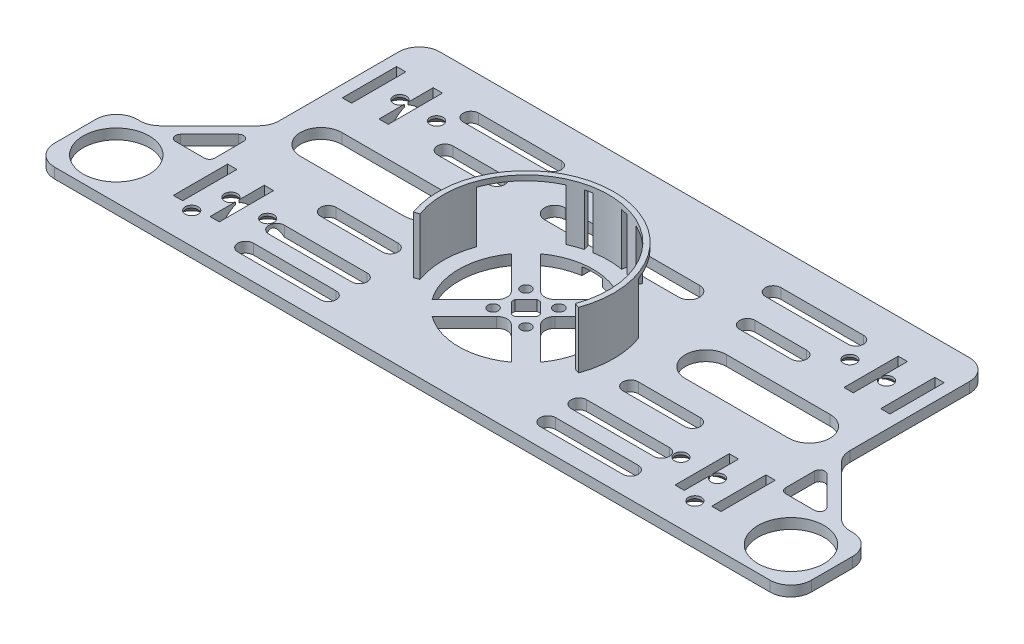
from build123d import *

# Parameters (mm, degrees)
SKETCH_1_R                     = 1
SKETCH_1_R_2                   = 6.4
SKETCH_1_W                     = 1.8
SKETCH_1_H                     = 10.5
EXTRUDE_1_DEPTH                = 2
FILLET_1_R                     = 2
FILLET_2_R                     = 4
FILLET_3_R                     = 1
HOLE_WIZARD_M2_5_3_AT_2_COUNT  = 2
HOLE_WIZARD_M2_5_3_AT_2_PITCH  = 7.1
HOLE_WIZARD_M2_5_3_AT_3_COUNT  = 2
HOLE_WIZARD_M2_5_3_AT_3_PITCH  = 87.1
HOLE_WIZARD_M2_5_3_AT_4_COUNT  = 2
HOLE_WIZARD_M2_5_3_AT_4_PITCH  = 94.2
HOLE_WIZARD_M2_5_3_AT_5_COUNT  = 2
HOLE_WIZARD_M2_5_3_AT_5_PITCH  = 99.714241711
HOLE_WIZARD_M2_5_3_AT_6_COUNT  = 2
HOLE_WIZARD_M2_5_3_AT_6_PITCH  = 103.321488568
HOLE_WIZARD_M2_5_3_AT_7_COUNT  = 2
HOLE_WIZARD_M2_5_3_AT_7_PITCH  = 93.036014532
HOLE_WIZARD_M2_5_3_AT_8_COUNT  = 2
HOLE_WIZARD_M2_5_3_AT_8_PITCH  = 33.461918654
HOLE_WIZARD_M2_5_3_AT_9_COUNT  = 2
HOLE_WIZARD_M2_5_3_AT_9_PITCH  = 38.733060814
HOLE_WIZARD_M2_5_3_AT_10_COUNT = 2
HOLE_WIZARD_M2_5_3_AT_10_PITCH = 32.7
CUT_EXTRUDE_1_DEPTH            = 2
EXTRUDE_2_DEPTH                = 10
EXTRUDE_3_DEPTH                = 1
CUT_EXTRUDE_2_DEPTH            = 1.5


with BuildPart() as part:
    # 草图1 → 凸台-拉伸1 (new body)
    with BuildSketch(Plane(origin=(0, 0, 0), x_dir=(1, 0, 0), z_dir=(0, 1, 0))):
        Polygon((-73.25, 16), (-73.25, 0), (73.25, 0), (73.25, 16), (67.078427125, 16), (55.25, 27.828427125), (55.25, 56.6), (-55.25, 56.6), (-55.25, 27.828427125), (-67.078427125, 16), align=None)
        with Locations(Location((-48.7, 6, 0), (0, 0, 270))):
            Circle(SKETCH_1_R, mode=Mode.SUBTRACT)
        with Locations(Location((-65.3, 8, 0), (0, 0, 270))):
            Circle(SKETCH_1_R_2, mode=Mode.SUBTRACT)
        with Locations((-52.1, 12)):
            Rectangle(SKETCH_1_W, SKETCH_1_H, mode=Mode.SUBTRACT)
        with Locations((-45, 12)):
            Rectangle(SKETCH_1_W, SKETCH_1_H, mode=Mode.SUBTRACT)
        Polygon((-55.25, 25), (-55.25, 16), (-64.25, 16), align=None, mode=Mode.SUBTRACT)
        with Locations(Location((-3.181980515, 18.818019485, 0), (0, 0, 270))):
            Circle(SKETCH_1_R, mode=Mode.SUBTRACT)
        with BuildLine():
            Line((-10.497164625, 29.6687375), (-2.828427125, 22))
            Line((-2.828427125, 22), (-10.497164625, 14.3312625))
            ThreePointArc((-10.497164625, 14.3312625), (-13, 22), (-10.497164625, 29.6687375))
        make_face(mode=Mode.SUBTRACT)
        with Locations(Location((-3.181980515, 25.181980515, 0), (0, 0, 270))):
            Circle(SKETCH_1_R, mode=Mode.SUBTRACT)
        with Locations(Location((48.7, 6, 0), (0, 0, 270))):
            Circle(SKETCH_1_R, mode=Mode.SUBTRACT)
        with Locations((45, 12)):
            Rectangle(SKETCH_1_W, SKETCH_1_H, mode=Mode.SUBTRACT)
        with Locations((52.1, 12)):
            Rectangle(SKETCH_1_W, SKETCH_1_H, mode=Mode.SUBTRACT)
        with Locations(Location((65.3, 8, 0), (0, 0, 270))):
            Circle(SKETCH_1_R_2, mode=Mode.SUBTRACT)
        with BuildLine():
            ThreePointArc((7.6687375, 11.502835375), (0, 9), (-7.6687375, 11.502835375))
            Line((-7.6687375, 11.502835375), (0, 19.171572875))
            Line((0, 19.171572875), (7.6687375, 11.502835375))
        make_face(mode=Mode.SUBTRACT)
        with Locations(Location((3.181980515, 18.818019485, 0), (0, 0, 270))):
            Circle(SKETCH_1_R, mode=Mode.SUBTRACT)
        with BuildLine():
            Line((0.353553391, 24.474873734), (2.474873734, 22.353553391))
            ThreePointArc((2.474873734, 22.353553391), (2.5, 22), (2.474873734, 21.646446609))
            Line((2.474873734, 21.646446609), (0.353553391, 19.525126266))
            ThreePointArc((0.353553391, 19.525126266), (0, 19.5), (-0.353553391, 19.525126266))
            Line((-0.353553391, 19.525126266), (-2.474873734, 21.646446609))
            ThreePointArc((-2.474873734, 21.646446609), (-2.5, 22), (-2.474873734, 22.353553391))
            Line((-2.474873734, 22.353553391), (-0.353553391, 24.474873734))
            ThreePointArc((-0.353553391, 24.474873734), (0, 24.5), (0.353553391, 24.474873734))
        make_face(mode=Mode.SUBTRACT)
        with BuildLine():
            Line((2.828427125, 22), (10.497164625, 29.6687375))
            ThreePointArc((10.497164625, 29.6687375), (13, 22), (10.497164625, 14.3312625))
            Line((10.497164625, 14.3312625), (2.828427125, 22))
        make_face(mode=Mode.SUBTRACT)
        with Locations(Location((3.181980515, 25.181980515, 0), (0, 0, 270))):
            Circle(SKETCH_1_R, mode=Mode.SUBTRACT)
        Polygon((64.25, 16), (55.25, 16), (55.25, 25), align=None, mode=Mode.SUBTRACT)
        with BuildLine():
            Line((7.6687375, 32.497164625), (0, 24.828427125))
            Line((0, 24.828427125), (-7.6687375, 32.497164625))
            ThreePointArc((-7.6687375, 32.497164625), (0, 35), (7.6687375, 32.497164625))
        make_face(mode=Mode.SUBTRACT)
        with Locations((-52.1, 44.7)):
            Rectangle(SKETCH_1_W, SKETCH_1_H, mode=Mode.SUBTRACT)
        with Locations((-45, 44.7)):
            Rectangle(SKETCH_1_W, SKETCH_1_H, mode=Mode.SUBTRACT)
        with BuildLine():
            ThreePointArc((-13, 38.6), (-15, 40.6), (-13, 42.6))
            Line((-13, 42.6), (13, 42.6))
            ThreePointArc((13, 42.6), (15, 40.6), (13, 38.6))
            Line((13, 38.6), (-13, 38.6))
        make_face(mode=Mode.SUBTRACT)
        with Locations((45, 44.7)):
            Rectangle(SKETCH_1_W, SKETCH_1_H, mode=Mode.SUBTRACT)
        with Locations((52.1, 44.7)):
            Rectangle(SKETCH_1_W, SKETCH_1_H, mode=Mode.SUBTRACT)
    extrude(amount=EXTRUDE_1_DEPTH)

    # 圆角1
    fillet_1_edges = [part.edges().sort_by_distance(p)[0] for p in [
        (2.828427125, 1, -22),
        (-2.828427125, 1, -22),
        (0, 1, -24.828427125),
        (0, 1, -19.171572875),
    ]]
    fillet(fillet_1_edges, radius=FILLET_1_R)

    # 圆角2
    fillet_2_edges = [part.edges().sort_by_distance(p)[0] for p in [
        (-55.25, 1, -56.6),
        (55.25, 1, -56.6),
        (55.25, 1, -27.828427125),
        (67.078427125, 1, -16),
        (73.25, 1, -16),
        (73.25, 1, 0),
        (-73.25, 1, 0),
        (-73.25, 1, -16),
        (-67.078427125, 1, -16),
        (-55.25, 1, -27.828427125),
    ]]
    fillet(fillet_2_edges, radius=FILLET_2_R)

    # 圆角3
    fillet_3_edges = [part.edges().sort_by_distance(p)[0] for p in [
        (55.25, 1, -25),
        (55.25, 1, -16),
        (64.25, 1, -16),
        (-55.25, 1, -16),
        (-55.25, 1, -25),
        (-64.25, 1, -16),
    ]]
    fillet(fillet_3_edges, radius=FILLET_3_R)

    # 草图9 → M2.5 平头机械螺钉的锥形沉头孔3 (revolve, cut)
    with BuildSketch(Plane(origin=(47.1, 0, -44.7), x_dir=(0, 0, -1), z_dir=(1, 0, 0))):
        Polygon((0, 0), (0, 2), (1.25, 2), (1.25, 1.5), (2.75, 0), align=None)
    hole_wizard_m2_5_3 = revolve(axis=Axis((47.1, -6.35, -44.7), (0, 1, 0)), mode=Mode.SUBTRACT)

    # M2.5 平头机械螺钉的锥形沉头孔3 at 2: M2.5 平头机械螺钉的锥形沉头孔3 ×2
    with Locations(*[(-i * HOLE_WIZARD_M2_5_3_AT_2_PITCH, 0, 0) for i in range(1, HOLE_WIZARD_M2_5_3_AT_2_COUNT)]):
        add(hole_wizard_m2_5_3, mode=Mode.SUBTRACT)

    # M2.5 平头机械螺钉的锥形沉头孔3 at 3: M2.5 平头机械螺钉的锥形沉头孔3 ×2
    with Locations(*[(-i * HOLE_WIZARD_M2_5_3_AT_3_PITCH, 0, 0) for i in range(1, HOLE_WIZARD_M2_5_3_AT_3_COUNT)]):
        add(hole_wizard_m2_5_3, mode=Mode.SUBTRACT)

    # M2.5 平头机械螺钉的锥形沉头孔3 at 4: M2.5 平头机械螺钉的锥形沉头孔3 ×2
    with Locations(*[(-i * HOLE_WIZARD_M2_5_3_AT_4_PITCH, 0, 0) for i in range(1, HOLE_WIZARD_M2_5_3_AT_4_COUNT)]):
        add(hole_wizard_m2_5_3, mode=Mode.SUBTRACT)

    # M2.5 平头机械螺钉的锥形沉头孔3 at 5: M2.5 平头机械螺钉的锥形沉头孔3 ×2
    with Locations(*[Vector(-0.9446995572910936, 0, 0.3279371074672885) * (i * HOLE_WIZARD_M2_5_3_AT_5_PITCH) for i in range(1, HOLE_WIZARD_M2_5_3_AT_5_COUNT)]):
        add(hole_wizard_m2_5_3, mode=Mode.SUBTRACT)

    # M2.5 平头机械螺钉的锥形沉头孔3 at 6: M2.5 平头机械螺钉的锥形沉头孔3 ×2
    with Locations(*[Vector(-0.9272030564729482, 0, 0.3745590635229948) * (i * HOLE_WIZARD_M2_5_3_AT_6_PITCH) for i in range(1, HOLE_WIZARD_M2_5_3_AT_6_COUNT)]):
        add(hole_wizard_m2_5_3, mode=Mode.SUBTRACT)

    # M2.5 平头机械螺钉的锥形沉头孔3 at 7: M2.5 平头机械螺钉的锥形沉头孔3 ×2
    with Locations(*[Vector(-0.9361965948147349, 0, 0.3514767927720053) * (i * HOLE_WIZARD_M2_5_3_AT_7_PITCH) for i in range(1, HOLE_WIZARD_M2_5_3_AT_7_COUNT)]):
        add(hole_wizard_m2_5_3, mode=Mode.SUBTRACT)

    # M2.5 平头机械螺钉的锥形沉头孔3 at 8: M2.5 平头机械螺钉的锥形沉头孔3 ×2
    with Locations(*[Vector(-0.21218149722485338, 0, 0.9772302759510778) * (i * HOLE_WIZARD_M2_5_3_AT_8_PITCH) for i in range(1, HOLE_WIZARD_M2_5_3_AT_8_COUNT)]):
        add(hole_wizard_m2_5_3, mode=Mode.SUBTRACT)

    # M2.5 平头机械螺钉的锥形沉头孔3 at 9: M2.5 平头机械螺钉的锥形沉头孔3 ×2
    with Locations(*[Vector(0.04130838013795448, 0, 0.9991464445867675) * (i * HOLE_WIZARD_M2_5_3_AT_9_PITCH) for i in range(1, HOLE_WIZARD_M2_5_3_AT_9_COUNT)]):
        add(hole_wizard_m2_5_3, mode=Mode.SUBTRACT)

    # M2.5 平头机械螺钉的锥形沉头孔3 at 10: M2.5 平头机械螺钉的锥形沉头孔3 ×2
    with Locations(*[(0, 0, i * HOLE_WIZARD_M2_5_3_AT_10_PITCH) for i in range(1, HOLE_WIZARD_M2_5_3_AT_10_COUNT)]):
        add(hole_wizard_m2_5_3, mode=Mode.SUBTRACT)

    # 草图10 → 切除-拉伸1 (cut)
    with BuildSketch(Plane.XZ):
        with BuildLine():
            Line((27.25, -25.6), (47.25, -25.6))
            ThreePointArc((47.25, -25.6), (51.25, -29.6), (47.25, -33.6))
            Line((47.25, -33.6), (27.25, -33.6))
            ThreePointArc((27.25, -33.6), (23.25, -29.6), (27.25, -25.6))
        make_face()
        with BuildLine():
            Line((-27.25, -25.6), (-47.25, -25.6))
            ThreePointArc((-47.25, -25.6), (-51.25, -29.6), (-47.25, -33.6))
            Line((-47.25, -33.6), (-27.25, -33.6))
            ThreePointArc((-27.25, -33.6), (-23.25, -29.6), (-27.25, -25.6))
        make_face()
        with BuildLine():
            Line((23.25, -17.5), (35.25, -17.5))
            ThreePointArc((35.25, -17.5), (36.75, -19), (35.25, -20.5))
            Line((35.25, -20.5), (23.25, -20.5))
            ThreePointArc((23.25, -20.5), (21.75, -19), (23.25, -17.5))
        make_face()
        with BuildLine():
            Line((21.25, -9.5), (37.25, -9.5))
            ThreePointArc((37.25, -9.5), (38.75, -11), (37.25, -12.5))
            Line((37.25, -12.5), (21.25, -12.5))
            ThreePointArc((21.25, -12.5), (19.75, -11), (21.25, -9.5))
        make_face()
        with BuildLine():
            Line((21.25, -3.5), (37.25, -3.5))
            ThreePointArc((37.25, -3.5), (38.75, -5), (37.25, -6.5))
            Line((37.25, -6.5), (21.25, -6.5))
            ThreePointArc((21.25, -6.5), (19.75, -5), (21.25, -3.5))
        make_face()
        with BuildLine():
            Line((24.25, -39.1), (34.25, -39.1))
            ThreePointArc((34.25, -39.1), (35.75, -40.6), (34.25, -42.1))
            Line((34.25, -42.1), (24.25, -42.1))
            ThreePointArc((24.25, -42.1), (22.75, -40.6), (24.25, -39.1))
        make_face()
        with BuildLine():
            Line((21.25, -47.1), (37.25, -47.1))
            ThreePointArc((37.25, -47.1), (38.75, -48.6), (37.25, -50.1))
            Line((37.25, -50.1), (21.25, -50.1))
            ThreePointArc((21.25, -50.1), (19.75, -48.6), (21.25, -47.1))
        make_face()
        with BuildLine():
            Line((-21.25, -3.5), (-37.25, -3.5))
            ThreePointArc((-37.25, -3.5), (-38.75, -5), (-37.25, -6.5))
            Line((-37.25, -6.5), (-21.25, -6.5))
            ThreePointArc((-21.25, -6.5), (-19.75, -5), (-21.25, -3.5))
        make_face()
        with BuildLine():
            Line((-21.25, -9.5), (-37.25, -9.5))
            ThreePointArc((-37.25, -9.5), (-38.75, -11), (-37.25, -12.5))
            Line((-37.25, -12.5), (-21.25, -12.5))
            ThreePointArc((-21.25, -12.5), (-19.75, -11), (-21.25, -9.5))
        make_face()
        with BuildLine():
            Line((-23.25, -17.5), (-35.25, -17.5))
            ThreePointArc((-35.25, -17.5), (-36.75, -19), (-35.25, -20.5))
            Line((-35.25, -20.5), (-23.25, -20.5))
            ThreePointArc((-23.25, -20.5), (-21.75, -19), (-23.25, -17.5))
        make_face()
        with BuildLine():
            Line((-21.25, -47.1), (-37.25, -47.1))
            ThreePointArc((-37.25, -47.1), (-38.75, -48.6), (-37.25, -50.1))
            Line((-37.25, -50.1), (-21.25, -50.1))
            ThreePointArc((-21.25, -50.1), (-19.75, -48.6), (-21.25, -47.1))
        make_face()
        with BuildLine():
            Line((-24.25, -39.1), (-34.25, -39.1))
            ThreePointArc((-34.25, -39.1), (-35.75, -40.6), (-34.25, -42.1))
            Line((-34.25, -42.1), (-24.25, -42.1))
            ThreePointArc((-24.25, -42.1), (-22.75, -40.6), (-24.25, -39.1))
        make_face()
    extrude(amount=-CUT_EXTRUDE_1_DEPTH, mode=Mode.SUBTRACT)

    # 草图12 → 凸台-拉伸2 (add)
    with BuildSketch(Plane(origin=(0, 2, 0), x_dir=(1, 0, 0), z_dir=(0, 1, 0))):
        with BuildLine():
            ThreePointArc((-15.974774553, 27.814342437), (-17, 22), (-15.974774553, 16.185657563))
            Line((-15.974774553, 16.185657563), (-15.035081933, 16.527677707))
            ThreePointArc((-15.035081933, 16.527677707), (-16, 22), (-15.035081933, 27.472322293))
            Line((-15.035081933, 27.472322293), (-15.974774553, 27.814342437))
        make_face()
        with BuildLine():
            Line((15.035081933, 16.527677707), (15.974774553, 16.185657563))
            ThreePointArc((15.974774553, 16.185657563), (17, 22), (15.974774553, 27.814342437))
            Line((15.974774553, 27.814342437), (15.035081933, 27.472322293))
            ThreePointArc((15.035081933, 27.472322293), (16, 22), (15.035081933, 16.527677707))
        make_face()
        with BuildLine():
            ThreePointArc((-4.399923767, 38.420739047), (-5.814342437, 37.974774553), (-7.18451045, 37.40723238))
            Line((-7.18451045, 37.40723238), (-6.761892188, 36.500924593))
            ThreePointArc((-6.761892188, 36.500924593), (-5.472322293, 37.035081933), (-4.141104722, 37.454813221))
            Line((-4.141104722, 37.454813221), (-4.399923767, 38.420739047))
        make_face()
        with BuildLine():
            ThreePointArc((4.141104722, 37.454813221), (5.472322293, 37.035081933), (6.761892188, 36.500924593))
            Line((6.761892188, 36.500924593), (7.18451045, 37.40723238))
            ThreePointArc((7.18451045, 37.40723238), (5.814342437, 37.974774553), (4.399923767, 38.420739047))
            Line((4.399923767, 38.420739047), (4.141104722, 37.454813221))
        make_face()
        with BuildLine():
            Line((-2.95201902, 38.741731801), (-2.778370843, 37.756924048))
            ThreePointArc((-2.778370843, 37.756924048), (0, 38), (2.778370843, 37.756924048))
            Line((2.778370843, 37.756924048), (2.95201902, 38.741731801))
            ThreePointArc((2.95201902, 38.741731801), (0, 39), (-2.95201902, 38.741731801))
        make_face()
    extrude(amount=EXTRUDE_2_DEPTH)

    # 草图13 → 凸台-拉伸3 (add)
    with BuildSketch(Plane(origin=(0, 12, 0), x_dir=(1, 0, 0), z_dir=(0, 1, 0))):
        with BuildLine():
            Line((-15.974774553, 16.185657563), (-15.035081933, 16.527677707))
            ThreePointArc((-15.035081933, 16.527677707), (-2.778370843, 37.756924048), (16, 22))
            ThreePointArc((16, 22), (15.756924048, 19.221629157), (15.035081933, 16.527677707))
            Line((15.035081933, 16.527677707), (15.974774553, 16.185657563))
            ThreePointArc((15.974774553, 16.185657563), (16.741731801, 19.04798098), (17, 22))
            ThreePointArc((17, 22), (-2.95201902, 38.741731801), (-15.974774553, 16.185657563))
        make_face()
    extrude(amount=EXTRUDE_3_DEPTH)

    # 草图14 → 切除-拉伸2 (cut)
    with BuildSketch(Plane.XZ):
        with BuildLine():
            ThreePointArc((2, -34.845232579), (1.00298965, -34.961250393), (0, -35))
            Line((0, -35), (0, -38.6))
            Line((0, -38.6), (2, -38.6))
            Line((2, -38.6), (2, -34.845232579))
        make_face()
        with BuildLine():
            ThreePointArc((0, -35), (-1.00298965, -34.961250393), (-2, -34.845232579))
            Line((-2, -34.845232579), (-2, -38.6))
            Line((-2, -38.6), (0, -38.6))
            Line((0, -38.6), (0, -35))
        make_face()
    extrude(amount=-CUT_EXTRUDE_2_DEPTH, mode=Mode.SUBTRACT)


solid = part.part
